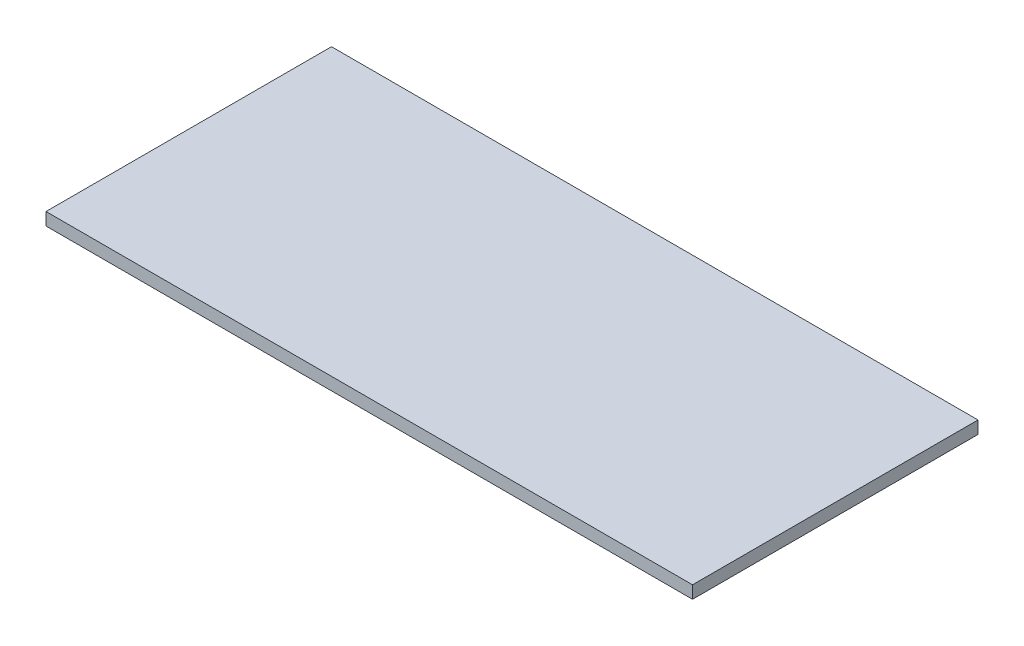
from build123d import *

# Parameters (mm, degrees)
SKETCH1_W   = 977.9
SKETCH1_H   = 431.8
GLASS_DEPTH = 19.05


with BuildPart() as part:
    # Sketch1 → Glass (new body)
    with BuildSketch(Plane(origin=(0, 0, 0), x_dir=(1, 0, 0), z_dir=(0, 1, 0))):
        Rectangle(SKETCH1_W, SKETCH1_H)
    extrude(amount=GLASS_DEPTH)


solid = part.part
